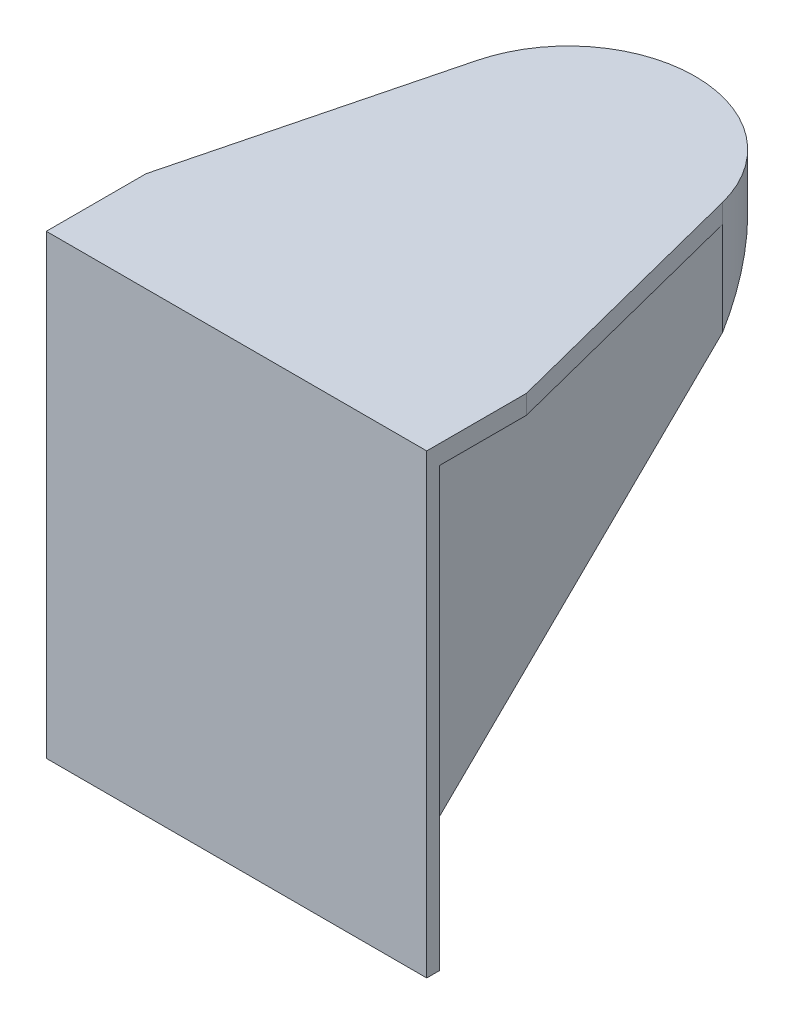
from build123d import *

# Parameters (mm, degrees)
BOSS_EXTRUDE1_DEPTH     = 15
BOSS_EXTRUDE2_DEPTH     = 10
SKETCH3_R               = 3.25
CUT_EXTRUDE1_DEPTH      = 9
CUT_EXTRUDE2_START      = -7
SKETCH4_R               = 6
CUT_EXTRUDE2_DEPTH      = 7
CHAMFER1_START          = 3
CHAMFER1_2_DEPTH        = 7
CHAMFER1_3_OUTLINE_R    = 12
CHAMFER1_3_OUTLINE_R_2  = 6
CHAMFER1_3_DEPTH        = 7
CHAMFER2_SIZE           = 5
CHAMFER2_SIZE2          = 3
SKETCH5_W               = 22
SKETCH5_H               = 32.792874394
CUT_EXTRUDE3_DEPTH      = 12
FILLET1_R               = 10
FILLET2_R               = 10
BOSS_EXTRUDE3_START     = 3
BOSS_EXTRUDE3_DEPTH     = 3
SKETCH7_W               = 60
SKETCH7_H               = 2
BOSS_EXTRUDE4_DEPTH     = 69
SKETCH8_W               = 60
SKETCH8_H               = 92.343979927
CUT_EXTRUDE4_DEPTH      = 416.45813754
BOSS_EXTRUDE5_START     = 69
BOSS_EXTRUDE5_DEPTH     = 69
CUT_EXTRUDE5_DEPTH      = 396.831589728
CUT_EXTRUDE5_DEPTH_BACK = 396.831589728


with BuildPart() as part:
    # Sketch1 → Boss-Extrude1 (new body)
    with BuildSketch(Plane(origin=(0, 0, 0), x_dir=(1, 0, 0), z_dir=(0, 1, 0))):
        with BuildLine():
            Line((-30, -408.070415552), (30, -408.070415552))
            Line((30, -408.070415552), (30, -372.350901436))
            ThreePointArc((30, -372.350901436), (0, -375.726435625), (-30, -372.350901436))
            Line((-30, -372.350901436), (-30, -408.070415552))
        make_face()
        with BuildLine():
            Line((-21, -395.210658494), (-21, -385.210658494))
            ThreePointArc((-21, -385.210658494), (-23, -383.210658494), (-25, -385.210658494))
            Line((-25, -385.210658494), (-25, -395.210658494))
            ThreePointArc((-25, -395.210658494), (-23, -397.210658494), (-21, -395.210658494))
        make_face(mode=Mode.SUBTRACT)
        with BuildLine():
            Line((25, -385.210658494), (25, -395.210658494))
            ThreePointArc((25, -395.210658494), (23, -397.210658494), (21, -395.210658494))
            Line((21, -395.210658494), (21, -385.210658494))
            ThreePointArc((21, -385.210658494), (23, -383.210658494), (25, -385.210658494))
        make_face(mode=Mode.SUBTRACT)
    extrude(amount=BOSS_EXTRUDE1_DEPTH)

    # Sketch2 → Boss-Extrude2 (add)
    with BuildSketch(Plane(origin=(0, 0, 0), x_dir=(1, 0, 0), z_dir=(0, 1, 0))):
        with BuildLine():
            Line((30, -372.350901436), (19.377517729, -330.775495649))
            ThreePointArc((19.377517729, -330.775495649), (0, -315.726435625), (-19.377517729, -330.775495649))
            Line((-19.377517729, -330.775495649), (-30, -372.350901436))
            ThreePointArc((-30, -372.350901436), (0, -375.726435625), (30, -372.350901436))
        make_face()
    extrude(amount=BOSS_EXTRUDE2_DEPTH)

    # Sketch3 → Cut-Extrude1 (cut)
    with BuildSketch(Plane(origin=(0, 10, 0), x_dir=(1, 0, 0), z_dir=(0, 1, 0))):
        with Locations(Location((0, -335.726435625, 0), (0, 0, 270))):
            Circle(SKETCH3_R)
    extrude(amount=-CUT_EXTRUDE1_DEPTH, mode=Mode.SUBTRACT)

    # Sketch4 → Cut-Extrude2 (cut)
    with BuildSketch(Plane(origin=(0, 10, 0), x_dir=(1, 0, 0), z_dir=(0, 1, 0)).offset(CUT_EXTRUDE2_START)):
        with BuildLine():
            Line((30, -372.350901436), (19.377517729, -330.775495649))
            ThreePointArc((19.377517729, -330.775495649), (0, -315.726435625), (-19.377517729, -330.775495649))
            Line((-19.377517729, -330.775495649), (-30, -372.350901436))
            ThreePointArc((-30, -372.350901436), (0, -375.726435625), (30, -372.350901436))
        make_face()
        with Locations(Location((0, -335.726435625, 0), (0, 0, 270))):
            Circle(SKETCH4_R, mode=Mode.SUBTRACT)
    extrude(amount=CUT_EXTRUDE2_DEPTH, mode=Mode.SUBTRACT)

    # Chamfer1: read off the stored shape, not the designer's step
    # Chamfer1 outline → Chamfer1 (revolve)
    with BuildSketch(Plane.XY.offset(335.726435625)):
        Polygon((26, 3), (12, 10), (12, 3), align=None)
    revolve(axis=Axis((0, 0, 335.726435625), (0, 1, 0)))

    # Chamfer1 2 outline → Chamfer1 2 (cut)
    with BuildSketch(Plane(origin=(0, 0, 0), x_dir=(1, 0, 0), z_dir=(0, 1, 0)).offset(CHAMFER1_START)):
        with BuildLine():
            ThreePointArc((-19.377517729, -330.775495649), (0, -315.726435625), (19.377517729, -330.775495649))
            Line((19.377517729, -330.775495649), (24.033863727, -349))
            Line((24.033863727, -349), (27, -349))
            Line((27, -349), (27, -308))
            Line((27, -308), (-27, -308))
            Line((-27, -308), (-27, -349))
            Line((-27, -349), (-24.033863727, -349))
            Line((-24.033863727, -349), (-19.377517729, -330.775495649))
        make_face()
    extrude(amount=CHAMFER1_2_DEPTH, mode=Mode.SUBTRACT)

    # Chamfer1 3 outline → Chamfer1 3 (add)
    with BuildSketch(Plane(origin=(0, 0, 0), x_dir=(1, 0, 0), z_dir=(0, 1, 0)).offset(CHAMFER1_START)):
        with Locations((0, -335.726435625)):
            Circle(CHAMFER1_3_OUTLINE_R)
        with Locations((0, -335.726435625)):
            Circle(CHAMFER1_3_OUTLINE_R_2, mode=Mode.SUBTRACT)
    extrude(amount=CHAMFER1_3_DEPTH)

    # Chamfer2
    chamfer2_edges = [part.edges().sort_by_distance(p)[0] for p in [
        (0, 10, 332.476435625),
    ]]
    chamfer2_side = [part.faces().sort_by_distance(p)[0] for p in [
        (-11.660588745, 10, 335.726435625),
    ]]
    chamfer(chamfer2_edges, length=CHAMFER2_SIZE, length2=CHAMFER2_SIZE2, reference=chamfer2_side[0])

    # Sketch5 → Cut-Extrude3 (cut)
    with BuildSketch(Plane(origin=(0, 15, 0), x_dir=(1, 0, 0), z_dir=(0, 1, 0))):
        with Locations((0, -391.673978355)):
            Rectangle(SKETCH5_W, SKETCH5_H)
    extrude(amount=-CUT_EXTRUDE3_DEPTH, mode=Mode.SUBTRACT)

    # Fillet1
    fillet1_edges = [part.edges().sort_by_distance(p)[0] for p in [
        (-11, 9, 375.277541158),
        (11, 9, 375.277541158),
    ]]
    fillet(fillet1_edges, radius=FILLET1_R)

    # Fillet2
    fillet2_edges = [part.edges().sort_by_distance(p)[0] for p in [
        (30, 7.5, 408.070415552),
        (-30, 7.5, 408.070415552),
    ]]
    fillet(fillet2_edges, radius=FILLET2_R)

    # Sketch6 → Boss-Extrude3 (add)
    with BuildSketch(Plane.XZ.offset(BOSS_EXTRUDE3_START)):
        with BuildLine():
            Line((-30, 388.070415552), (30, 388.070415552))
            Line((30, 388.070415552), (30, 372.350901436))
            Line((30, 372.350901436), (19.377517729, 330.775495649))
            ThreePointArc((19.377517729, 330.775495649), (0, 315.726435625), (-19.377517729, 330.775495649))
            Line((-19.377517729, 330.775495649), (-30, 372.350901436))
            Line((-30, 372.350901436), (-30, 388.070415552))
        make_face()
    extrude(amount=-BOSS_EXTRUDE3_DEPTH)

    # Sketch7 → Boss-Extrude4 (add)
    with BuildSketch(Plane.XZ.offset(3)):
        with Locations((0, 387.070415552)):
            Rectangle(SKETCH7_W, SKETCH7_H)
    extrude(amount=BOSS_EXTRUDE4_DEPTH)

    # Sketch8 → Cut-Extrude4 (cut, through all)
    with BuildSketch(Plane(origin=(0, 0, 0), x_dir=(1, 0, 0), z_dir=(0, 1, 0))):
        with Locations((0, -361.898425589)):
            Rectangle(SKETCH8_W, SKETCH8_H)
    extrude(amount=CUT_EXTRUDE4_DEPTH, mode=Mode.SUBTRACT)

    # Sketch9 → Boss-Extrude5 (add)
    with BuildSketch(Plane.XZ.offset(3).offset(BOSS_EXTRUDE5_START)):
        with BuildLine():
            Line((-2.5, 386.070415552), (2.5, 386.070415552))
            Line((2.5, 386.070415552), (2.5, 315.883300792))
            ThreePointArc((2.5, 315.883300792), (0, 315.726435625), (-2.5, 315.883300792))
            Line((-2.5, 315.883300792), (-2.5, 386.070415552))
        make_face()
        with BuildLine():
            Line((14.377517729, 386.070415552), (19.377517729, 386.070415552))
            Line((19.377517729, 386.070415552), (19.377517729, 330.775495649))
            ThreePointArc((19.377517729, 330.775495649), (17.460939697, 325.973713704), (14.377517729, 321.823666695))
            Line((14.377517729, 321.823666695), (14.377517729, 386.070415552))
        make_face()
        with BuildLine():
            Line((-19.377517729, 386.070415552), (-19.377517729, 330.775495649))
            ThreePointArc((-19.377517729, 330.775495649), (-17.460939697, 325.973713704), (-14.377517729, 321.823666695))
            Line((-14.377517729, 321.823666695), (-14.377517729, 386.070415552))
            Line((-14.377517729, 386.070415552), (-19.377517729, 386.070415552))
        make_face()
    extrude(amount=-BOSS_EXTRUDE5_DEPTH)

    # Sketch10 → Cut-Extrude5 (cut, two sides: drawn at the far end of the back side and taken through both)
    with BuildSketch(Plane(origin=(0, 0, 0), x_dir=(0, 0, -1), z_dir=(1, 0, 0)).offset(-CUT_EXTRUDE5_DEPTH_BACK)):
        Polygon((-386.070415552, -72), (-315.726435625, -72), (-315.726435625, -3), align=None)
    extrude(amount=CUT_EXTRUDE5_DEPTH + CUT_EXTRUDE5_DEPTH_BACK, mode=Mode.SUBTRACT)


solid = part.part
